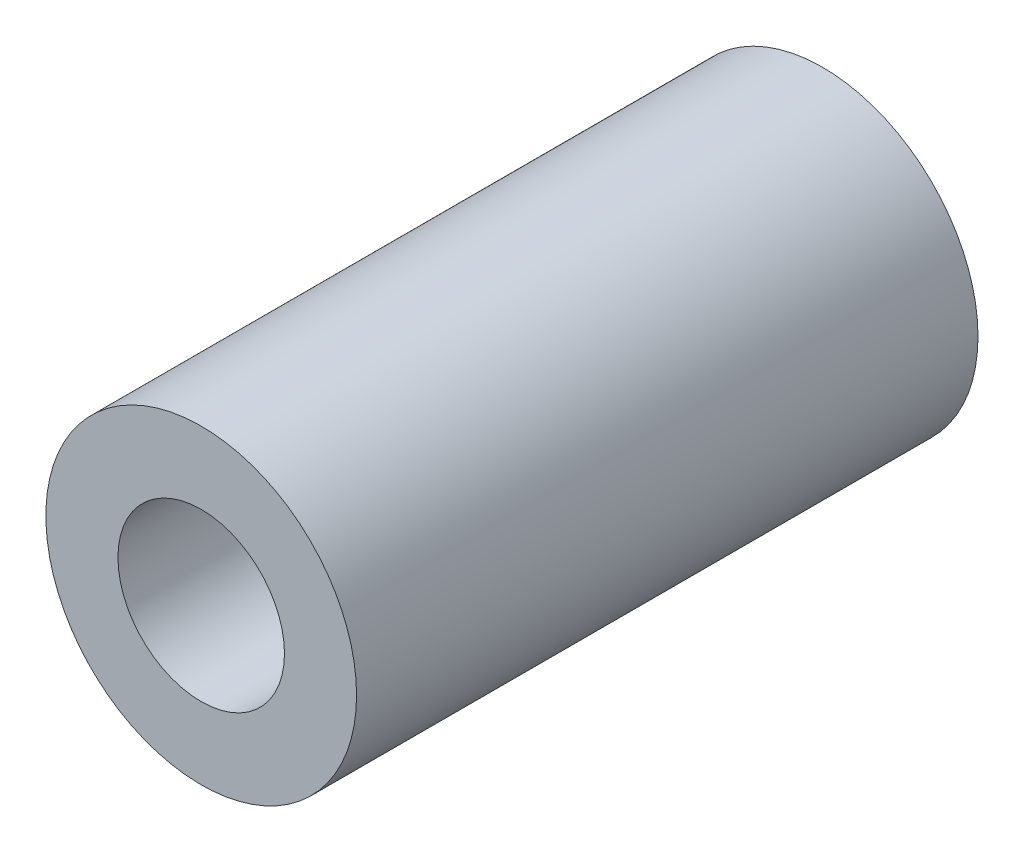
from build123d import *

# Parameters (mm, degrees)
SKETCH1_R           = 4.7625
SKETCH1_R_2         = 2.5527
BOSS_EXTRUDE1_DEPTH = 9.525


with BuildPart() as part:
    # Sketch1 → Boss-Extrude1 (new, symmetric)
    with BuildSketch(Plane.XY):
        Circle(SKETCH1_R)
        Circle(SKETCH1_R_2, mode=Mode.SUBTRACT)
    extrude(amount=BOSS_EXTRUDE1_DEPTH, both=True)


solid = part.part
